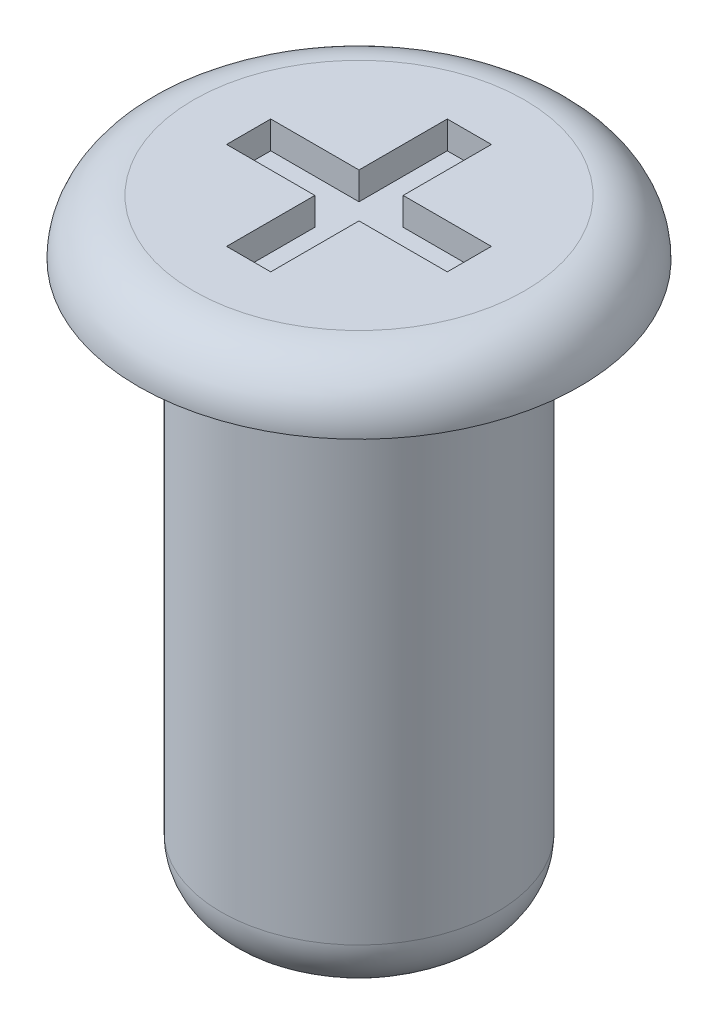
from build123d import *

# Parameters (mm, degrees)
SKETCH1_R           = 6.35
BOSS_EXTRUDE1_DEPTH = 25.4
SKETCH2_R           = 10.16
BOSS_EXTRUDE2_DEPTH = 2.54
FILLET1_R           = 2.54
SKETCH3_W           = 4.064
SKETCH3_H           = 2.032
SKETCH3_W_2         = 2.032
SKETCH3_H_2         = 4.064
CUT_EXTRUDE1_DEPTH  = 1.27
FILLET2_R           = 2.54


with BuildPart() as part:
    # Sketch1 → Boss-Extrude1 (new body)
    with BuildSketch(Plane(origin=(0, 0, 0), x_dir=(1, 0, 0), z_dir=(0, 1, 0))):
        with Locations(Location((0, 0, 0), (0, 0, 270))):
            Circle(SKETCH1_R)
    extrude(amount=BOSS_EXTRUDE1_DEPTH)

    # Sketch2 → Boss-Extrude2 (add)
    with BuildSketch(Plane(origin=(0, 25.4, 0), x_dir=(1, 0, 0), z_dir=(0, 1, 0))):
        with Locations(Location((0, 0, 0), (0, 0, 270))):
            Circle(SKETCH2_R)
    extrude(amount=BOSS_EXTRUDE2_DEPTH)

    # Fillet1
    fillet1_edges = [part.edges().sort_by_distance(p)[0] for p in [
        (0, 27.94, -10.16),
    ]]
    fillet(fillet1_edges, radius=FILLET1_R - 0.0001)  # a hair under: the kernel refuses the full size

    # Sketch3 → Cut-Extrude1 (cut)
    with BuildSketch(Plane(origin=(0, 27.94, 0), x_dir=(1, 0, 0), z_dir=(0, 1, 0))):
        with Locations((-3.048, 0)):
            Rectangle(SKETCH3_W, SKETCH3_H)
        with Locations((0, 3.048)):
            Rectangle(SKETCH3_W_2, SKETCH3_H_2)
        with Locations((3.048, 0)):
            Rectangle(SKETCH3_W, SKETCH3_H)
        Rectangle(SKETCH3_W_2, SKETCH3_H)
        with Locations((0, -3.048)):
            Rectangle(SKETCH3_W_2, SKETCH3_H_2)
    extrude(amount=-CUT_EXTRUDE1_DEPTH, mode=Mode.SUBTRACT)

    # Fillet2
    fillet2_edges = [part.edges().sort_by_distance(p)[0] for p in [
        (0, 0, -6.35),
    ]]
    fillet(fillet2_edges, radius=FILLET2_R)


solid = part.part
